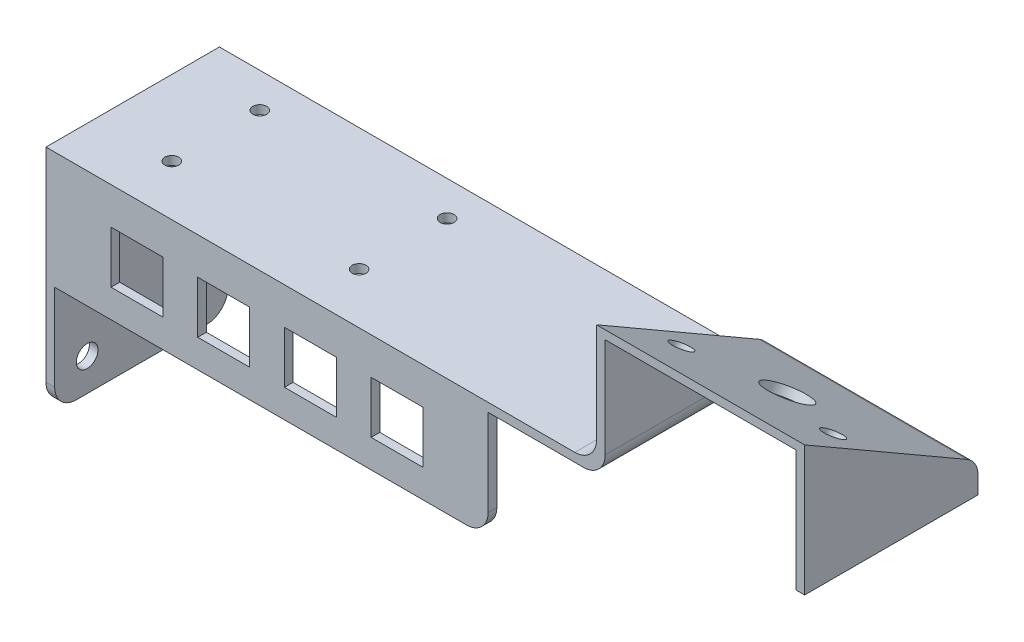
from build123d import *

# Parameters (mm, degrees)
SKETCH1_W           = 175
SKETCH1_H           = 2
BOSS_EXTRUDE1_DEPTH = 40
SKETCH2_W           = 2
SKETCH2_H           = 40
BOSS_EXTRUDE2_DEPTH = 50
SKETCH3_W           = 100
SKETCH3_H           = 25
BOSS_EXTRUDE3_DEPTH = 2
SKETCH4_R           = 2.5
CUT_EXTRUDE1_DEPTH  = 2
SKETCH5_W           = 12
SKETCH5_H           = 12
CUT_EXTRUDE2_DEPTH  = 2
FILLET1_R           = 5
SKETCH6_R           = 1.6
CUT_EXTRUDE3_DEPTH  = 2
BOSS_EXTRUDE4_DEPTH = 48
SHELL1_DEPTH        = 5.751288694
SHELL1_START        = 4
SHELL1_2_DEPTH      = 1.751288694
SHELL1_START_2      = 129
SHELL1_3_DEPTH      = 44
SKETCH8_R           = 5
SKETCH8_R_2         = 2.383029524
CUT_EXTRUDE4_DEPTH  = 44
SKETCH10_W          = 44
SKETCH10_H          = 28
CUT_EXTRUDE5_DEPTH  = 2
BOSS_EXTRUDE5_REACH = 146.017
SKETCH12_W          = 5.470592624
SKETCH12_H          = 9.51694338
SKETCH12_W_2        = 4.594349632
SKETCH12_H_2        = 8.868192378
CUT_EXTRUDE6_DEPTH  = 188.459328922
SKETCH13_W          = 40
SKETCH13_H          = 2
BOSS_EXTRUDE6_DEPTH = 2
SKETCH14_W          = 3
SKETCH14_H          = 2
BOSS_EXTRUDE7_DEPTH = 2
FILLET3_R           = 5
FILLET4_R           = 5


with BuildPart() as part:
    # Sketch1 → Boss-Extrude1 (new body)
    with BuildSketch(Plane.XY):
        with Locations((87.5, 1)):
            Rectangle(SKETCH1_W, SKETCH1_H)
    extrude(amount=BOSS_EXTRUDE1_DEPTH)

    # Sketch2 → Boss-Extrude2 (add)
    with BuildSketch(Plane.XZ):
        with Locations((1, 20)):
            Rectangle(SKETCH2_W, SKETCH2_H)
    extrude(amount=BOSS_EXTRUDE2_DEPTH)

    # Sketch3 → Boss-Extrude3 (add)
    with BuildSketch(Plane.XY.offset(40)):
        with Locations((52, -12.5)):
            Rectangle(SKETCH3_W, SKETCH3_H)
    extrude(amount=-BOSS_EXTRUDE3_DEPTH)

    # Sketch4 → Cut-Extrude1 (cut)
    with BuildSketch(Plane.ZY):
        with Locations((7.5, -8.5)):
            Circle(SKETCH4_R)
        with Locations((32.5, -42.5)):
            Circle(SKETCH4_R)
    extrude(amount=-CUT_EXTRUDE1_DEPTH, mode=Mode.SUBTRACT)

    # Sketch5 → Cut-Extrude2 (cut)
    with BuildSketch(Plane.XY.offset(40)):
        with Locations((21, -12.5)):
            Rectangle(SKETCH5_W, SKETCH5_H)
        with Locations((41, -12.5)):
            Rectangle(SKETCH5_W, SKETCH5_H)
        with Locations((61, -12.5)):
            Rectangle(SKETCH5_W, SKETCH5_H)
        with Locations((81, -12.5)):
            Rectangle(SKETCH5_W, SKETCH5_H)
    extrude(amount=-CUT_EXTRUDE2_DEPTH, mode=Mode.SUBTRACT)

    # Fillet1
    fillet1_edges = [part.edges().sort_by_distance(p)[0] for p in [
        (175, 1, 40),
        (1, -50, 0),
        (1, -50, 40),
        (102, -25, 39),
        (175, 1, 0),
    ]]
    fillet(fillet1_edges, radius=FILLET1_R)

    # Sketch6 → Cut-Extrude3 (cut)
    with BuildSketch(Plane(origin=(0, 2, 0), x_dir=(1, 0, 0), z_dir=(0, 1, 0))):
        with Locations(Location((17.323948769, -8, 0), (0, 0, 270))):
            Circle(SKETCH6_R)
        with Locations(Location((60.523948769, -8, 0), (0, 0, 270))):
            Circle(SKETCH6_R)
        with Locations(Location((17.323948769, -28.3, 0), (0, 0, 270))):
            Circle(SKETCH6_R)
        with Locations(Location((60.523948769, -28.3, 0), (0, 0, 270))):
            Circle(SKETCH6_R)
    extrude(amount=-CUT_EXTRUDE3_DEPTH, mode=Mode.SUBTRACT)

    # Sketch7 → Boss-Extrude4 (add)
    with BuildSketch(Plane(origin=(127, 0, 0), x_dir=(0, 0, -1), z_dir=(1, 0, 0))):
        Polygon((0, 6.905989232), (-40, 30), (-40, 2), (0, 2), align=None)
    extrude(amount=BOSS_EXTRUDE4_DEPTH)

    # Shell1: read off the stored shape, not the designer's step
    # Shell1 outline → Shell1 (cut)
    with BuildSketch(Plane(origin=(0, 0, 0), x_dir=(1, 0, 0), z_dir=(0, 1, 0))):
        with BuildLine():
            Line((129, -38), (170, -38))
            ThreePointArc((170, -38), (172.121320344, -37.121320344), (173, -35))
            Line((173, -35), (173, -5))
            ThreePointArc((173, -5), (172.121320344, -2.878679656), (170, -2))
            Line((170, -2), (129, -2))
            Line((129, -2), (129, -38))
        make_face()
    extrude(amount=SHELL1_DEPTH, mode=Mode.SUBTRACT)

    # Shell1 2 outline → Shell1 2 (cut)
    with BuildSketch(Plane(origin=(0, 0, 0), x_dir=(1, 0, 0), z_dir=(0, 1, 0)).offset(SHELL1_START)):
        with BuildLine():
            Line((170, -38), (173, -38))
            Line((173, -38), (173, -35))
            ThreePointArc((173, -35), (172.121320344, -37.121320344), (170, -38))
        make_face()
        with BuildLine():
            ThreePointArc((170, -2), (172.121320344, -2.878679656), (173, -5))
            Line((173, -5), (173, -2))
            Line((173, -2), (170, -2))
        make_face()
    extrude(amount=SHELL1_2_DEPTH, mode=Mode.SUBTRACT)

    # Shell1 3 outline → Shell1 3 (cut)
    with BuildSketch(Plane.YZ.offset(SHELL1_START_2)):
        Polygon((26.535898385, 38), (5.751288694, 38), (5.751288694, 2), align=None)
    extrude(amount=SHELL1_3_DEPTH, mode=Mode.SUBTRACT)

    # Sketch8 → Cut-Extrude4 (cut)
    with BuildSketch(Plane(origin=(0, 5.179491924, -2.990381057), x_dir=(1, 0, 0), z_dir=(0, 0.8660254037844417, -0.49999999999999495))):
        with Locations(Location((151, -26.546994616, 0), (0, 0, 270))):
            Circle(SKETCH8_R)
        with Locations(Location((168.5, -34.546994616, 0), (0, 0, 270))):
            Circle(SKETCH8_R_2)
        with Locations(Location((133.5, -34.546994616, 0), (0, 0, 270))):
            Circle(SKETCH8_R_2)
    extrude(amount=-CUT_EXTRUDE4_DEPTH, mode=Mode.SUBTRACT)

    # Sketch10 → Cut-Extrude5 (cut)
    with BuildSketch(Plane.XY.offset(40)):
        with Locations((151, 14)):
            Rectangle(SKETCH10_W, SKETCH10_H)
    extrude(amount=-CUT_EXTRUDE5_DEPTH, mode=Mode.SUBTRACT)

    # Sketch11 → Boss-Extrude5 (add, up to next)
    with BuildSketch(Plane(origin=(129, 0, 0), x_dir=(0, 0, -1), z_dir=(1, 0, 0)), mode=Mode.PRIVATE) as boss_extrude5_sk1:
        Polygon((-38, 26.535898385), (-40, 28), (-38, 28), align=None)
    boss_extrude5_tool1 = extrude(boss_extrude5_sk1.sketch, amount=BOSS_EXTRUDE5_REACH, mode=Mode.PRIVATE) - part.part
    add(boss_extrude5_tool1.solids().sort_by_distance((129, 27.511966, 38.666667))[0])

    # Sketch12 → Cut-Extrude6 (cut, through all)
    with BuildSketch(Plane(origin=(0, 4, 0), x_dir=(1, 0, 0), z_dir=(0, 1, 0))):
        with Locations((170.264703688, -39.75847169)):
            Rectangle(SKETCH12_W, SKETCH12_H)
        with Locations((170.702825184, -6.434096189)):
            Rectangle(SKETCH12_W_2, SKETCH12_H_2)
    extrude(amount=-CUT_EXTRUDE6_DEPTH, mode=Mode.SUBTRACT)

    # Sketch13 → Boss-Extrude6 (add)
    with BuildSketch(Plane(origin=(175, 0, 0), x_dir=(0, 0, -1), z_dir=(1, 0, 0))):
        with Locations((-20, 1)):
            Rectangle(SKETCH13_W, SKETCH13_H)
    extrude(amount=-BOSS_EXTRUDE6_DEPTH)

    # Sketch14 → Boss-Extrude7 (add)
    with BuildSketch(Plane(origin=(0, 0, 0), x_dir=(-1, 0, 0), z_dir=(0, 0, -1))):
        with Locations((-171.5, 1)):
            Rectangle(SKETCH14_W, SKETCH14_H)
    extrude(amount=-BOSS_EXTRUDE7_DEPTH)

    # Fillet3
    fillet3_edges = [part.edges().sort_by_distance(p)[0] for p in [
        (129, 0, 21),
        (127, 2, 20),
    ]]
    fillet(fillet3_edges, radius=FILLET3_R)

    # Fillet4
    fillet4_edges = [part.edges().sort_by_distance(p)[0] for p in [
        (151, 5.751288694, 2),
        (150.99955806, 6.905989232, 0),
    ]]
    fillet(fillet4_edges, radius=FILLET4_R)


solid = part.part
